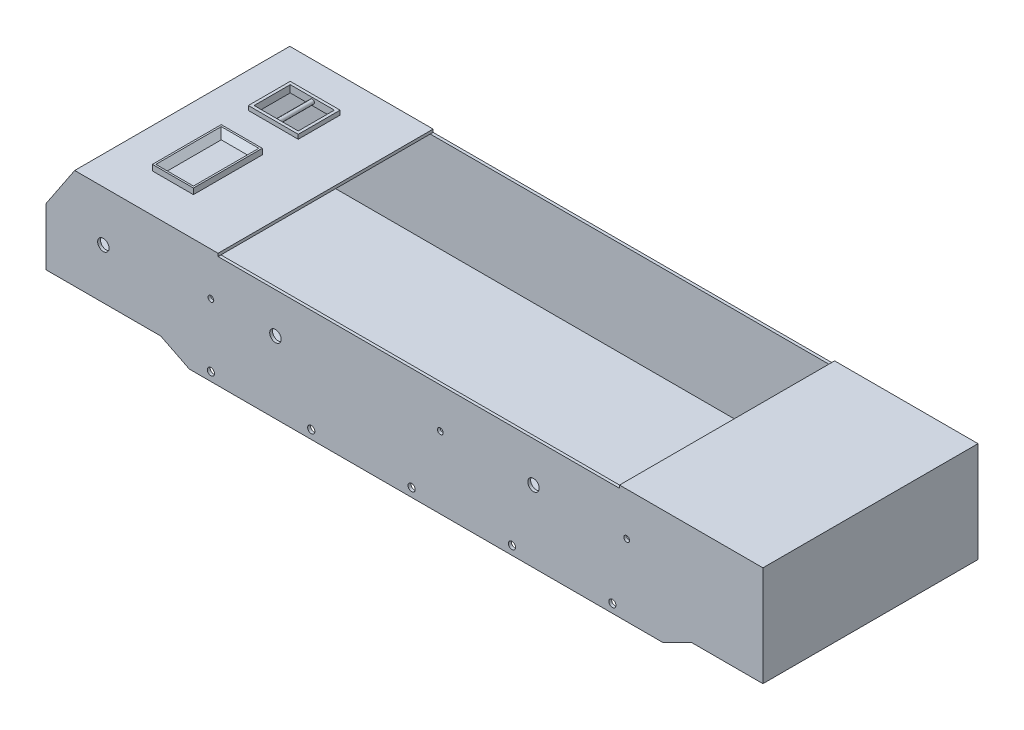
from build123d import *

# Parameters (mm, degrees)
EXTRUDE_1_DEPTH        = 150
SHELL_START            = 2
SHELL_1_DEPTH          = 146
SKETCH_3_W             = 500
SKETCH_3_H             = 2
EXTRUDE_2_DEPTH        = 10
CUT_EXTRUDE_1_DEPTH    = 10
SKETCH_5_R             = 2.5
CUT_EXTRUDE_2_DEPTH    = 2
PATTERN_LINEAR_1_COUNT = 5
PATTERN_LINEAR_1_PITCH = 70
SKETCH_6_R             = 2
CUT_EXTRUDE_3_DEPTH    = 2
SKETCH_7_R             = 4
CUT_EXTRUDE_4_DEPTH    = 2
CUT_EXTRUDE_5_REACH    = 297
SKETCH_8_R             = 4
SKETCH_9_W             = 28.6
SKETCH_9_H             = 48
SKETCH_9_W_2           = 18.2
SKETCH_9_H_2           = 37.6
EXTRUDE_3_DEPTH        = 4
CHAMFER_1_SIZE         = 4
SKETCH_11_W            = 34.8
SKETCH_11_H            = 29.2
SKETCH_11_W_2          = 30.8
SKETCH_11_H_2          = 25.2
EXTRUDE_4_DEPTH        = 3
CUT_EXTRUDE_6_REACH    = 304.324
SKETCH_11_2_W          = 30.8
SKETCH_11_2_H          = 25.2
EXTRUDE_5_REACH        = 274.555
SKETCH_14_R            = 1.5
SKETCH_9_2_W           = 18.2
SKETCH_9_2_H           = 37.6
EXTRUDE_6_DEPTH        = 3


# Read off the part's stored shape, not the designer's step: 抽壳1
with BuildPart() as part:
    # 草图1 → 凸台-拉伸1 (new body)
    with BuildSketch(Plane.XY):
        Polygon((-250, 5), (-230, 35), (-130, 35), (-130, 33), (150, 33), (150, 35), (250, 35), (250, -35), (-250, -35), align=None)
    extrude(amount=EXTRUDE_1_DEPTH)

    # 抽壳1 outline → 抽壳1 (cut)
    with BuildSketch(Plane.XY.offset(SHELL_START)):
        Polygon((248, 33), (-228.929632483, 33), (-248, 4.394448725), (-248, -33), (248, -33), align=None)
    extrude(amount=SHELL_1_DEPTH, mode=Mode.SUBTRACT)

    # 草图3 → 凸台-拉伸2 (add)
    with BuildSketch(Plane.XZ.offset(35)):
        with Locations((0, 149)):
            Rectangle(SKETCH_3_W, SKETCH_3_H)
    extrude_2 = extrude(amount=EXTRUDE_2_DEPTH)

    # 草图4 → 切除-拉伸1 (cut)
    with BuildSketch(Plane.XY.offset(150)):
        Polygon((-150, -45), (-170, -35), (-250, -35), (-250, -45), align=None)
        Polygon((250, -35), (200, -35), (180, -45), (250, -45), align=None)
    cut_extrude_1 = extrude(amount=-CUT_EXTRUDE_1_DEPTH, mode=Mode.SUBTRACT)

    # 镜向1: 凸台-拉伸2, 切除-拉伸1 across plane
    add(extrude_2.mirror(Plane(origin=(0, 0, 75), x_dir=(1, 0, 0), z_dir=(0, 0, -1))))
    add(cut_extrude_1.mirror(Plane(origin=(0, 0, 75), x_dir=(1, 0, 0), z_dir=(0, 0, -1))), mode=Mode.SUBTRACT)

    # 草图5 → 切除-拉伸2 (cut)
    with BuildSketch(Plane.XY.offset(150)):
        with Locations((-135, -39)):
            Circle(SKETCH_5_R)
    cut_extrude_2 = extrude(amount=-CUT_EXTRUDE_2_DEPTH, mode=Mode.SUBTRACT)

    # 阵列(线性)1: 切除-拉伸2 ×5
    with Locations(*[(i * PATTERN_LINEAR_1_PITCH, 0, 0) for i in range(1, PATTERN_LINEAR_1_COUNT)]):
        add(cut_extrude_2, mode=Mode.SUBTRACT)

    # 草图6 → 切除-拉伸3 (cut)
    with BuildSketch(Plane.XY.offset(150)):
        with Locations((-135, 5)):
            Circle(SKETCH_6_R)
        with Locations((25, 5)):
            Circle(SKETCH_6_R)
        with Locations((155, 5)):
            Circle(SKETCH_6_R)
    extrude(amount=-CUT_EXTRUDE_3_DEPTH, mode=Mode.SUBTRACT)

    # 草图7 → 切除-拉伸4 (cut)
    with BuildSketch(Plane.XY.offset(150)):
        with Locations((-90, 5)):
            Circle(SKETCH_7_R)
        with Locations((90, 5)):
            Circle(SKETCH_7_R)
    extrude(amount=-CUT_EXTRUDE_4_DEPTH, mode=Mode.SUBTRACT)

    # 草图8 → 切除-拉伸5 (cut, up to next)
    with BuildSketch(Plane.XY.offset(150), mode=Mode.PRIVATE) as cut_extrude_5_sk1:
        with Locations((-210, 0)):
            Circle(SKETCH_8_R)
    cut_extrude_5_tool1 = extrude(cut_extrude_5_sk1.sketch, amount=-CUT_EXTRUDE_5_REACH, mode=Mode.PRIVATE) & part.part
    add(cut_extrude_5_tool1.solids().sort_by_distance((-210, 0, 150))[0], mode=Mode.SUBTRACT)

    # 草图9 → 凸台-拉伸3 (add)
    with BuildSketch(Plane(origin=(0, 35, 0), x_dir=(1, 0, 0), z_dir=(0, 1, 0))):
        with Locations((-188.276603419, -99.2)):
            Rectangle(SKETCH_9_W, SKETCH_9_H)
        with Locations((-188.276603419, -99.2)):
            Rectangle(SKETCH_9_W_2, SKETCH_9_H_2, mode=Mode.SUBTRACT)
    extrude(amount=EXTRUDE_3_DEPTH)

    # 倒角1
    chamfer_1_edges = [part.edges().sort_by_distance(p)[0] for p in [
        (-188.276603419, 39, 80.4),
        (-179.176603419, 39, 99.2),
        (-188.276603419, 39, 118),
        (-197.376603419, 39, 99.2),
    ]]
    chamfer(chamfer_1_edges, length=CHAMFER_1_SIZE - 0.0001)  # a hair under: the kernel refuses the full size

    # 草图11 → 凸台-拉伸4 (add)
    with BuildSketch(Plane(origin=(0, 35, 0), x_dir=(1, 0, 0), z_dir=(0, 1, 0))):
        with Locations((-188.276603419, -38.6)):
            Rectangle(SKETCH_11_W, SKETCH_11_H)
        with Locations((-188.276603419, -38.6)):
            Rectangle(SKETCH_11_W_2, SKETCH_11_H_2, mode=Mode.SUBTRACT)
    extrude(amount=EXTRUDE_4_DEPTH)

    # 草图11<2> → 切除-拉伸6 (cut, up to next)
    with BuildSketch(Plane(origin=(0, 35, 0), x_dir=(1, 0, 0), z_dir=(0, 1, 0)), mode=Mode.PRIVATE) as cut_extrude_6_sk1:
        with Locations((-188.276603419, -38.6)):
            Rectangle(SKETCH_11_2_W, SKETCH_11_2_H)
    cut_extrude_6_tool1 = extrude(cut_extrude_6_sk1.sketch, amount=-CUT_EXTRUDE_6_REACH, mode=Mode.PRIVATE) & part.part
    add(cut_extrude_6_tool1.solids().sort_by_distance((-188.276603, 35, 38.6))[0], mode=Mode.SUBTRACT)

    # 草图14 → 凸台-拉伸5 (add, up to next)
    with BuildSketch(Plane(origin=(0, 0, 51.2), x_dir=(-1, 0, 0), z_dir=(0, 0, -1)), mode=Mode.PRIVATE) as extrude_5_sk1:
        with Locations(Location((188.276603419, 35.5, 0), (0, 0, 180))):
            Circle(SKETCH_14_R)
    extrude_5_tool1 = extrude(extrude_5_sk1.sketch, amount=EXTRUDE_5_REACH, mode=Mode.PRIVATE) - part.part
    add(extrude_5_tool1.solids().sort_by_distance((-188.276603, 35.5, 51.2))[0])

    # 草图9<2> → 凸台-拉伸6 (add)
    with BuildSketch(Plane(origin=(0, 35, 0), x_dir=(1, 0, 0), z_dir=(0, 1, 0))):
        with Locations((-188.276603419, -99.2)):
            Rectangle(SKETCH_9_2_W, SKETCH_9_2_H)
    extrude(amount=-EXTRUDE_6_DEPTH)


solid = part.part
